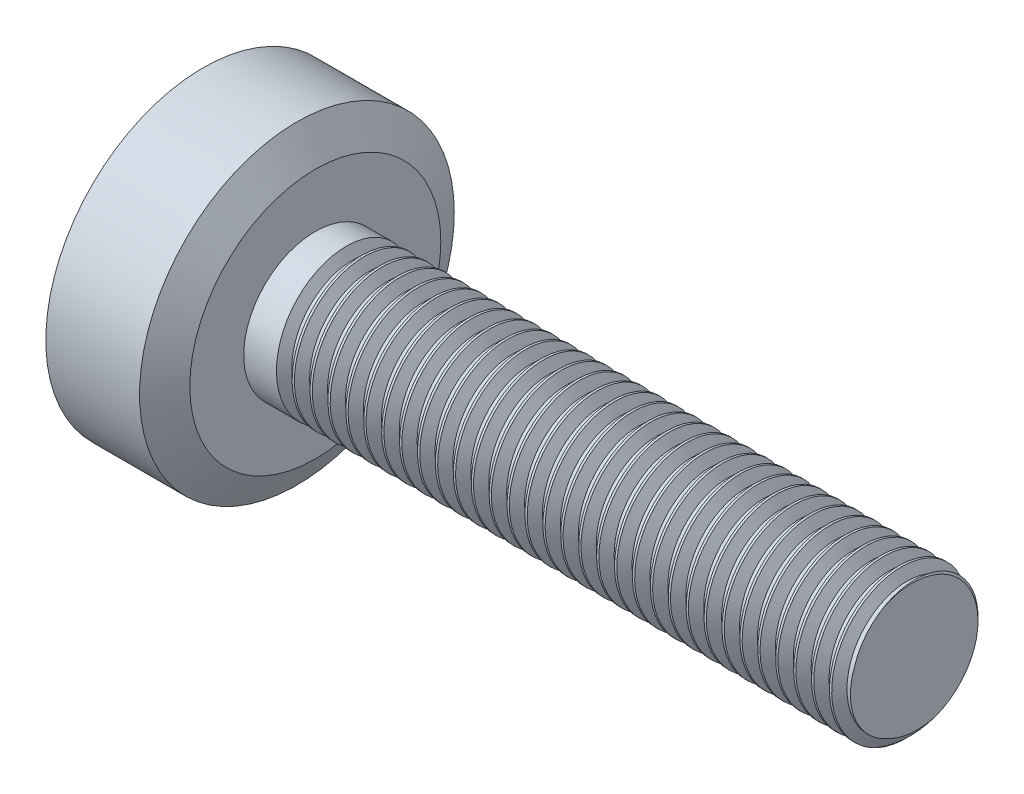
from build123d import *

# Parameters (mm, degrees)
CHAMFER1_SIZE      = 0.5
CUT_EXTRUDE1_DEPTH = 8
THREAD1_PITCH      = 1.5


with BuildPart() as part:
    # Sketch3 → Revolve1 (revolve)
    with BuildSketch(Plane(origin=(0, 0, 0), x_dir=(1, 0, 0), z_dir=(0, 1, 0))):
        Polygon((0, 0), (0, 9), (2.609225754, 13.177570093), (10.460044159, 13.177570093), (12, 10.510288335), (12, 6), (62, 6), (62, 0), align=None)
    revolve(axis=Axis((62, 0, 0), (-1, 0, 0)))

    # Chamfer1
    chamfer1_edges = [part.edges().sort_by_distance(p)[0] for p in [
        (62, 0, 6),
    ]]
    chamfer(chamfer1_edges, length=CHAMFER1_SIZE)

    # Sketch4 → Cut-Extrude1 (cut)
    with BuildSketch(Plane.ZY):
        Polygon((4.5, -2.598076211), (4.5, 2.598076211), (0, 5.196152423), (-4.5, 2.598076211), (-4.5, -2.598076211), (0, -5.196152423), align=None)
    extrude(amount=-CUT_EXTRUDE1_DEPTH, mode=Mode.SUBTRACT)

    # Sketch5 → Cut-Revolve1 (revolve, cut)
    with BuildSketch(Plane.XY, mode=Mode.PRIVATE) as cut_revolve1_sk:
        Polygon((0, 0), (0, 6), (3.464101615, 0), align=None)
        Polygon((7.764345993, 0), (7.764345993, 5.740727864), (11.07875677, 0), align=None)
    revolve(cut_revolve1_sk.sketch.rotate(Axis((0, 0, 0), (1, 0, 0)), 90), axis=Axis((0, 0, 0), (1, 0, 0)), mode=Mode.SUBTRACT)

    # Thread1: the profile of Thread Profile1 profile screwed along a right-hand helix of 32 turns, 8 arcs to a turn; built about Z, then put on its axis
    thread1_z = Axis((0, 0, 0), (0, 0, 1))
    thread1_corners = [(6.0003, 0, -0.000173205), (6.0003, 0, 1.312673201), (5.188101188, 0, 0.843749998), (5.188101188, 0, 0.468749998)]
    with BuildLine(mode=Mode.PRIVATE) as thread1_profile:
        Line(thread1_corners[0], thread1_corners[1])
        Line(thread1_corners[1], thread1_corners[2])
        Line(thread1_corners[2], thread1_corners[3])
        Line(thread1_corners[3], thread1_corners[0])
    thread1_cap = Face(thread1_profile.wire())
    thread1_turn_angles = [0, 22.5, 45, 67.5, 90, 112.5, 135, 157.5, 180, 202.5, 225, 247.5, 270, 292.5, 315, 337.5, 360]
    thread1_turn_weights = [1, 0.9238795325112867, 1, 0.9238795325112867, 1, 0.9238795325112867, 1, 0.9238795325112867, 1, 0.9238795325112867, 1, 0.9238795325112867, 1, 0.9238795325112867, 1, 0.9238795325112867, 1]
    thread1_turn_rails = [Edge.make_bspline([Vector(p[0], p[1], 0).rotate(thread1_z, thread1_turn_angles[k]) / thread1_turn_weights[k] + Vector(0, 0, p[2] + THREAD1_PITCH * thread1_turn_angles[k] / 360) for k in range(17)], [0, 0, 0, 1, 1, 2, 2, 3, 3, 4, 4, 5, 5, 6, 6, 7, 7, 8, 8, 8], 2, thread1_turn_weights) for p in thread1_corners]
    thread1_turn_sides = [Face.make_surface_from_curves(thread1_turn_rails[p[0]], thread1_turn_rails[p[1]]) for p in [(0, 1), (1, 2), (2, 3), (3, 0)]]
    thread1 = Plane(origin=(14, 0, 0), x_dir=(0, 0, -1), z_dir=(1, 0, 0)) * Solid(Shell([*[p.moved(Location((0, 0, THREAD1_PITCH * i))) for i in range(32) for p in thread1_turn_sides], thread1_cap, thread1_cap.rotate(thread1_z, 11520).moved(Location((0, 0, THREAD1_PITCH * 11520 / 360)))]))
    add(thread1, mode=Mode.SUBTRACT)


solid = part.part
